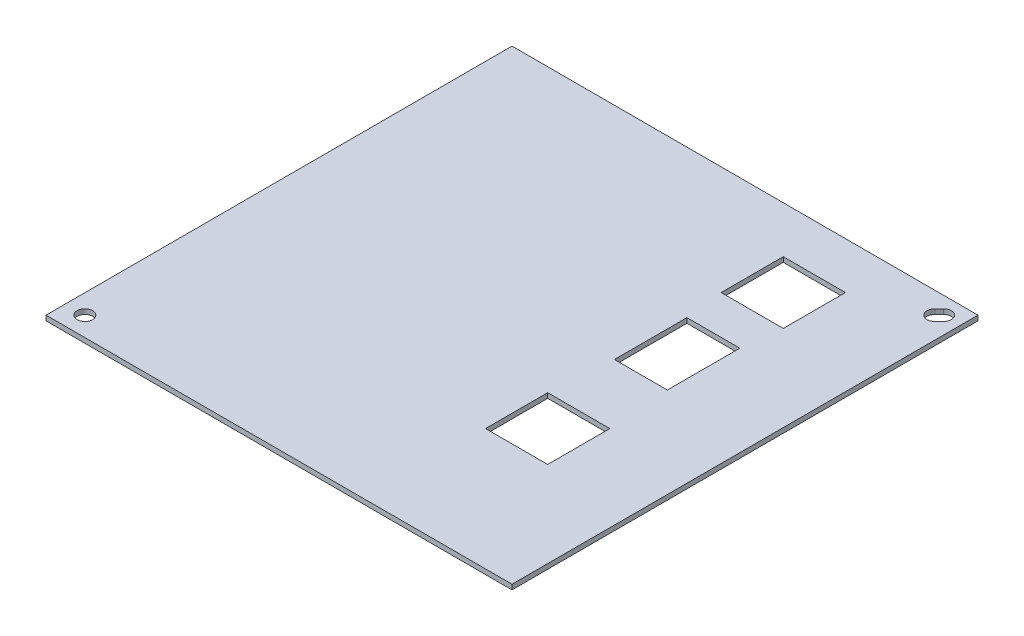
from build123d import *

# Parameters (mm, degrees)
SKETCH1_W           = 300
SKETCH1_H           = 300
BOSS_EXTRUDE1_DEPTH = 3.175
SKETCH2_R           = 5
CUT_EXTRUDE1_DEPTH  = 213.155793286
SKETCH3_W           = 34.06
SKETCH3_H           = 46.67
CUT_EXTRUDE2_DEPTH  = 213.155793286
SKETCH4_W           = 40
SKETCH4_H           = 40
CUT_EXTRUDE3_DEPTH  = 213.155793286


with BuildPart() as part:
    # Sketch1 → Boss-Extrude1 (new body)
    with BuildSketch(Plane(origin=(0, 0, 0), x_dir=(1, 0, 0), z_dir=(0, 1, 0))):
        Rectangle(SKETCH1_W, SKETCH1_H)
    extrude(amount=BOSS_EXTRUDE1_DEPTH)

    # Sketch2 → Cut-Extrude1 (cut, through all)
    with BuildSketch(Plane(origin=(0, 3.175, 0), x_dir=(1, 0, 0), z_dir=(0, 1, 0))):
        with Locations((-137.5, -137.5)):
            Circle(SKETCH2_R)
        with BuildLine():
            Line((142.449747468, 135.378679656), (139.621320344, 132.550252532))
            ThreePointArc((139.621320344, 132.550252532), (132.550252532, 132.550252532), (132.550252532, 139.621320344))
            Line((132.550252532, 139.621320344), (135.378679656, 142.449747468))
            ThreePointArc((135.378679656, 142.449747468), (142.449747468, 142.449747468), (142.449747468, 135.378679656))
        make_face()
    extrude(amount=-CUT_EXTRUDE1_DEPTH, mode=Mode.SUBTRACT)

    # Sketch3 → Cut-Extrude2 (cut, through all)
    with BuildSketch(Plane(origin=(0, 3.175, 0), x_dir=(1, 0, 0), z_dir=(0, 1, 0))):
        with Locations((74.716012632, 31.592141137)):
            Rectangle(SKETCH3_W, SKETCH3_H)
    extrude(amount=-CUT_EXTRUDE2_DEPTH, mode=Mode.SUBTRACT)

    # Sketch4 → Cut-Extrude3 (cut, through all)
    with BuildSketch(Plane(origin=(0, 3.175, 0), x_dir=(1, 0, 0), z_dir=(0, 1, 0))):
        with Locations((74.716012632, -51.742858863)):
            Rectangle(SKETCH4_W, SKETCH4_H)
        with Locations((74.716012632, 99.927141137)):
            Rectangle(SKETCH4_W, SKETCH4_H)
    extrude(amount=-CUT_EXTRUDE3_DEPTH, mode=Mode.SUBTRACT)


solid = part.part
